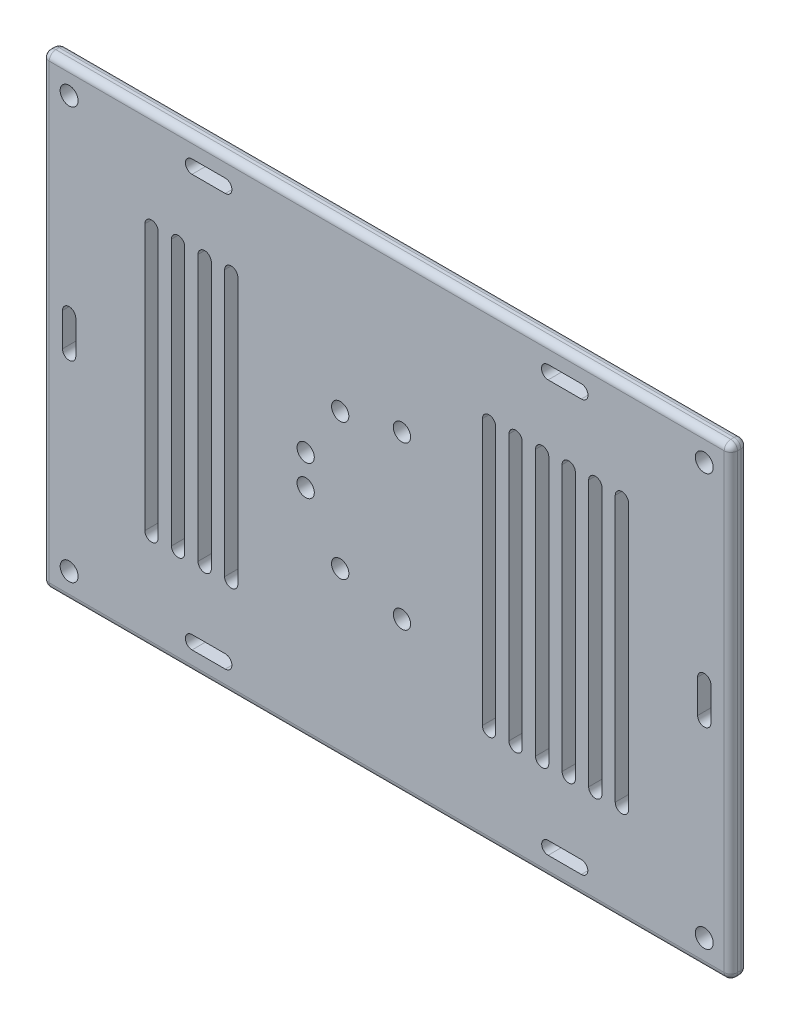
from build123d import *

# Parameters (mm, degrees)
ESQUISSE1_W                         = 103.6
ESQUISSE1_H                         = 70
BOSS_EXTRU_1_DEPTH                  = 2.5
CONG_3_R                            = 1
ENL_V_MAT_EXTRU_2_DEPTH             = 63.565885273
R_P_TITION_LIN_AIRE1_COUNT          = 6
R_P_TITION_LIN_AIRE1_PITCH          = 4
ENL_V_MAT_EXTRU_3_DEPTH             = 63.565885273
R_P_TITION_LIN_AIRE2_COUNT          = 4
R_P_TITION_LIN_AIRE2_PITCH          = 4
DIAM_TRE_DU_PER_AGE_2_7_2_7_1_D     = 2.7
DIAM_TRE_DU_PER_AGE_2_7_2_7_1_DEPTH = 5
DIAM_TRE_DU_PER_AGE_2_7_2_7_1_TIP   = 0.811161836
ESQUISSE52_R                        = 2.5
BOSS_EXTRU_2_DEPTH                  = 7
ESQUISSE50_R                        = 2.5
BOSS_EXTRU_3_DEPTH                  = 7
ESQUISSE54_R                        = 2.5
BOSS_EXTRU_4_DEPTH                  = 7
CONG_4_R                            = 0.5
DIAM_TRE_DU_PER_AGE_2_6_2_6_3_D     = 2.6
DIAM_TRE_DU_PER_AGE_2_6_2_6_3_DEPTH = 15
DIAM_TRE_DU_PER_AGE_2_6_2_6_3_TIP   = 0.781118805
CONG_5_R                            = 0.5


with BuildPart() as part:
    # Esquisse1 → Boss.-Extru.1 (new body)
    with BuildSketch(Plane.XY):
        Rectangle(ESQUISSE1_W, ESQUISSE1_H)
        with BuildLine():
            Line((24.3, -30.028322307), (29.3, -30.028322307))
            ThreePointArc((29.3, -30.028322307), (30.271677693, -31), (29.3, -31.971677693))
            Line((29.3, -31.971677693), (24.3, -31.971677693))
            ThreePointArc((24.3, -31.971677693), (23.328322307, -31), (24.3, -30.028322307))
        make_face(mode=Mode.SUBTRACT)
        with BuildLine():
            Line((-29.3, -30), (-24.3, -30))
            ThreePointArc((-24.3, -30), (-23.3, -31), (-24.3, -32))
            Line((-24.3, -32), (-29.3, -32))
            ThreePointArc((-29.3, -32), (-30.3, -31), (-29.3, -30))
        make_face(mode=Mode.SUBTRACT)
        with BuildLine():
            Line((29.3, 30), (24.3, 30))
            ThreePointArc((24.3, 30), (23.3, 31), (24.3, 32))
            Line((24.3, 32), (29.3, 32))
            ThreePointArc((29.3, 32), (30.3, 31), (29.3, 30))
        make_face(mode=Mode.SUBTRACT)
        with BuildLine():
            Line((-29.3, 32), (-24.3, 32))
            ThreePointArc((-24.3, 32), (-23.3, 31), (-24.3, 30))
            Line((-24.3, 30), (-29.3, 30))
            ThreePointArc((-29.3, 30), (-30.3, 31), (-29.3, 32))
        make_face(mode=Mode.SUBTRACT)
        with BuildLine():
            Line((-46.8, 2.5), (-46.8, -2.5))
            ThreePointArc((-46.8, -2.5), (-47.8, -3.5), (-48.8, -2.5))
            Line((-48.8, -2.5), (-48.8, 2.5))
            ThreePointArc((-48.8, 2.5), (-47.8, 3.5), (-46.8, 2.5))
        make_face(mode=Mode.SUBTRACT)
        with BuildLine():
            Line((48.8, 2.5), (48.8, -2.5))
            ThreePointArc((48.8, -2.5), (47.8, -3.5), (46.8, -2.5))
            Line((46.8, -2.5), (46.8, 2.5))
            ThreePointArc((46.8, 2.5), (47.8, 3.5), (48.8, 2.5))
        make_face(mode=Mode.SUBTRACT)
    extrude(amount=BOSS_EXTRU_1_DEPTH)

    # Congé3
    cong_3_edges = [part.edges().sort_by_distance(p)[0] for p in [
        (-51.8, 0, 2.5),
        (0, -35, 2.5),
        (0, 35, 2.5),
        (51.8, 0, 2.5),
        (51.8, -35, 1.25),
        (51.8, 35, 1.25),
        (-51.8, 35, 1.25),
        (-51.8, -35, 1.25),
        (51.8, 0, 0),
        (0, 35, 0),
        (-51.8, 0, 0),
        (0, -35, 0),
    ]]
    fillet(cong_3_edges, radius=CONG_3_R)

    # Esquisse36 → Enlèv. mat.-Extru.2 (cut, through all)
    with BuildSketch(Plane.XY.offset(2.5)):
        with BuildLine():
            Line((36.4, 20), (36.4, -20))
            ThreePointArc((36.4, -20), (35.4, -21), (34.4, -20))
            Line((34.4, -20), (34.4, 20))
            ThreePointArc((34.4, 20), (35.4, 21), (36.4, 20))
        make_face()
    enl_v_mat_extru_2 = extrude(amount=-ENL_V_MAT_EXTRU_2_DEPTH, mode=Mode.SUBTRACT)

    # Répétition linéaire1: Enlèv. mat.-Extru.2 ×6
    with Locations(*[(-i * R_P_TITION_LIN_AIRE1_PITCH, 0, 0) for i in range(1, R_P_TITION_LIN_AIRE1_COUNT)]):
        add(enl_v_mat_extru_2, mode=Mode.SUBTRACT)

    # Esquisse37 → Enlèv. mat.-Extru.3 (cut, through all)
    with BuildSketch(Plane.XY.offset(2.5)):
        with BuildLine():
            Line((-34.4, 20), (-34.4, -20))
            ThreePointArc((-34.4, -20), (-35.4, -21), (-36.4, -20))
            Line((-36.4, -20), (-36.4, 20))
            ThreePointArc((-36.4, 20), (-35.4, 21), (-34.4, 20))
        make_face()
    enl_v_mat_extru_3 = extrude(amount=-ENL_V_MAT_EXTRU_3_DEPTH, mode=Mode.SUBTRACT)

    # Répétition linéaire2: Enlèv. mat.-Extru.3 ×4
    with Locations(*[(i * R_P_TITION_LIN_AIRE2_PITCH, 0, 0) for i in range(1, R_P_TITION_LIN_AIRE2_COUNT)]):
        add(enl_v_mat_extru_3, mode=Mode.SUBTRACT)

    # Diamètre du perçage Ø2.7 (2.7)1
    with Locations(Plane(origin=(-47.8, 31, 2.5), x_dir=(1, 0, 0), z_dir=(0, 0, 1))):
        with Locations((0, 0), (0, -62), (95.6, -62), (95.6, 0)):
            Hole(DIAM_TRE_DU_PER_AGE_2_7_2_7_1_D / 2, depth=DIAM_TRE_DU_PER_AGE_2_7_2_7_1_DEPTH)
            with Locations((0, 0, -(DIAM_TRE_DU_PER_AGE_2_7_2_7_1_DEPTH + DIAM_TRE_DU_PER_AGE_2_7_2_7_1_TIP / 2))):  # 118° drill point
                Cone(0, DIAM_TRE_DU_PER_AGE_2_7_2_7_1_D / 2, DIAM_TRE_DU_PER_AGE_2_7_2_7_1_TIP, mode=Mode.SUBTRACT)

    # Esquisse52 → Boss.-Extru.2 (add)
    with BuildSketch(Plane.XY.offset(2.5)):
        with Locations((2.298097039, -12.197591975)):
            Circle(ESQUISSE52_R)
        with Locations((-12.197591975, 2.298097039)):
            Circle(ESQUISSE52_R)
    extrude(amount=-BOSS_EXTRU_2_DEPTH)

    # Esquisse50 → Boss.-Extru.3 (add)
    with BuildSketch(Plane.XY.offset(2.5)):
        with Locations((-7, 10.25)):
            Circle(ESQUISSE50_R)
        with Locations((-7, -10.25)):
            Circle(ESQUISSE50_R)
    extrude(amount=-BOSS_EXTRU_3_DEPTH)

    # Esquisse54 → Boss.-Extru.4 (add)
    with BuildSketch(Plane.XY.offset(2.5)):
        with Locations((-12.197591975, -2.298097039)):
            Circle(ESQUISSE54_R)
        with Locations((2.298097039, 12.197591975)):
            Circle(ESQUISSE54_R)
    extrude(amount=-BOSS_EXTRU_4_DEPTH)

    # Congé4
    cong_4_edges = [part.edges().sort_by_distance(p)[0] for p in [
        (-0.201902961, 12.197591975, 0),
        (-0.201902961, 12.197591975, -4.5),
        (-9.5, 10.25, 0),
        (-9.5, 10.25, -4.5),
        (-12.197591975, 4.798097039, 0),
        (-12.197591975, 4.798097039, -4.5),
        (-13.18184296, 0, -2.25),
        (-12.197591975, -4.798097039, 0),
        (-11.213340991, 0, -2.25),
        (-12.197591975, -4.798097039, -4.5),
        (-9.5, -10.25, 0),
        (-9.5, -10.25, -4.5),
        (-0.201902961, -12.197591975, 0),
        (-0.201902961, -12.197591975, -4.5),
    ]]
    fillet(cong_4_edges, radius=CONG_4_R)

    # Diamètre du perçage Ø2.6 (2.6)3
    with Locations(Plane(origin=(2.298097039, -12.197591975, -4.5), x_dir=(-1, 0, 0), z_dir=(0, 0, -1))):
        with Locations((0, 0), (9.298097039, 1.947591975), (0, 24.39518395), (9.298097039, 22.447591975), (14.495689014, 14.495689014), (14.495689014, 9.899494936)):
            Hole(DIAM_TRE_DU_PER_AGE_2_6_2_6_3_D / 2, depth=DIAM_TRE_DU_PER_AGE_2_6_2_6_3_DEPTH)
            with Locations((0, 0, -(DIAM_TRE_DU_PER_AGE_2_6_2_6_3_DEPTH + DIAM_TRE_DU_PER_AGE_2_6_2_6_3_TIP / 2))):  # 118° drill point
                Cone(0, DIAM_TRE_DU_PER_AGE_2_6_2_6_3_D / 2, DIAM_TRE_DU_PER_AGE_2_6_2_6_3_TIP, mode=Mode.SUBTRACT)

    # Congé5
    cong_5_edges = [part.edges().sort_by_distance(p)[0] for p in [
        (0.998097039, -12.197591975, -4.5),
        (-13.497591975, -2.298097039, -4.5),
        (-13.497591975, 2.298097039, -4.5),
        (-8.3, 10.25, -4.5),
        (0.998097039, 12.197591975, -4.5),
        (-8.3, -10.25, -4.5),
    ]]
    fillet(cong_5_edges, radius=CONG_5_R)


solid = part.part
